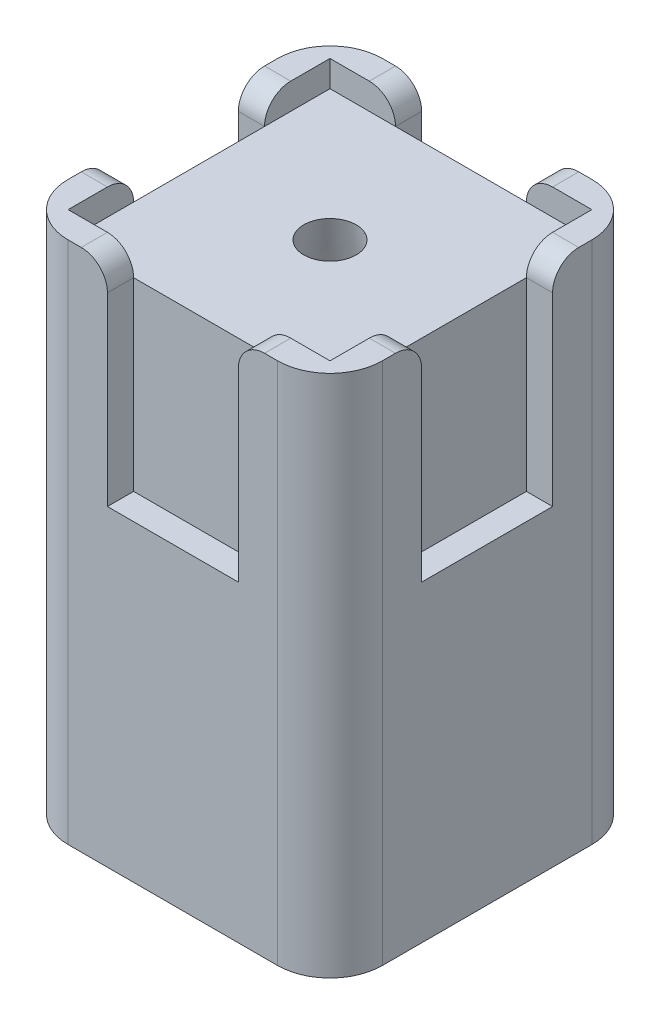
from build123d import *

# Parameters (mm, degrees)
SKETCH2_W           = 30
SKETCH2_H           = 30
BOSS_EXTRUDE1_DEPTH = 50
SKETCH3_W           = 25
SKETCH3_H           = 25
CUT_EXTRUDE1_DEPTH  = 2.5
FILLET1_R           = 5
SKETCH9_W           = 12.5
SKETCH9_H           = 20.172460503
CUT_EXTRUDE2_DEPTH  = 2.5
CIRPATTERN1_COUNT   = 4
FILLET2_R           = 2.5


with BuildPart() as part:
    # Sketch2 → Boss-Extrude1 (new body)
    with BuildSketch(Plane(origin=(0, 0, 0), x_dir=(1, 0, 0), z_dir=(0, 1, 0))):
        Rectangle(SKETCH2_W, SKETCH2_H)
    extrude(amount=BOSS_EXTRUDE1_DEPTH)

    # Sketch3 → Cut-Extrude1 (cut)
    with BuildSketch(Plane(origin=(0, 50, 0), x_dir=(1, 0, 0), z_dir=(0, 1, 0))):
        Rectangle(SKETCH3_W, SKETCH3_H)
    extrude(amount=-CUT_EXTRUDE1_DEPTH, mode=Mode.SUBTRACT)

    # Fillet1
    fillet1_edges = [part.edges().sort_by_distance(p)[0] for p in [
        (15, 25, 15),
        (-15, 25, 15),
        (-15, 25, -15),
        (15, 25, -15),
    ]]
    fillet(fillet1_edges, radius=FILLET1_R)

    # Cut-Loft2: read off the stored shape, not the designer's step
    # Cut-Loft2: loft between two sections, ruled curve by curve
    cut_loft2_from = [
        Edge.make_bspline([(0, 0, -12.5), (-25, 0, -12.5), (-25, 0, 12.5), (0, 0, 12.5), (25, 0, 12.5), (25, 0, -12.5), (0, 0, -12.5)], [0, 0, 0, 0, 0.5, 0.5, 0.5, 1, 1, 1, 1], 3, [1, 0.333333333, 0.333333333, 1, 0.333333333, 0.333333333, 1]),
    ]
    cut_loft2_to = [
        Edge.make_bspline([(0.784484005, 47.5, -2.373728048), (-3.962972092, 47.5, -3.942696057), (-5.531940101, 47.5, 0.804760039), (-0.784484005, 47.5, 2.373728048), (3.962972092, 47.5, 3.942696057), (5.531940101, 47.5, -0.804760039), (0.784484005, 47.5, -2.373728048)], [0, 0, 0, 0, 0.5, 0.5, 0.5, 1, 1, 1, 1], 3, [1, 0.333333333, 0.333333333, 1, 0.333333333, 0.333333333, 1]),
    ]
    cut_loft2 = Solid(Shell([*[Face.make_surface_from_curves(cut_loft2_from[k], cut_loft2_to[k]) for k in range(1)], Face(Wire(cut_loft2_from)), Face(Wire(cut_loft2_to))]))
    add(cut_loft2, mode=Mode.SUBTRACT)

    # Sketch9 → Cut-Extrude2 (cut)
    with BuildSketch(Plane.XY.offset(15)):
        with Locations((0, 39.913769749)):
            Rectangle(SKETCH9_W, SKETCH9_H)
    cut_extrude2 = extrude(amount=-CUT_EXTRUDE2_DEPTH, mode=Mode.SUBTRACT)

    # CirPattern1: Cut-Loft2, Cut-Extrude2 ×4 about axis
    cirpattern1_axis = Axis((0, 0, 0), (0, 1, 0))
    add([cut_loft2.rotate(cirpattern1_axis, i * 360 / CIRPATTERN1_COUNT) for i in range(1, CIRPATTERN1_COUNT)], mode=Mode.SUBTRACT)
    add([cut_extrude2.rotate(cirpattern1_axis, i * 360 / CIRPATTERN1_COUNT) for i in range(1, CIRPATTERN1_COUNT)], mode=Mode.SUBTRACT)

    # Fillet2
    fillet2_edges = [part.edges().sort_by_distance(p)[0] for p in [
        (13.75, 50, 6.25),
        (13.75, 50, -6.25),
        (6.25, 50, -13.75),
        (-6.25, 50, -13.75),
        (-13.75, 50, -6.25),
        (-13.75, 50, 6.25),
        (-6.25, 50, 13.75),
        (6.25, 50, 13.75),
    ]]
    fillet(fillet2_edges, radius=FILLET2_R)


solid = part.part
